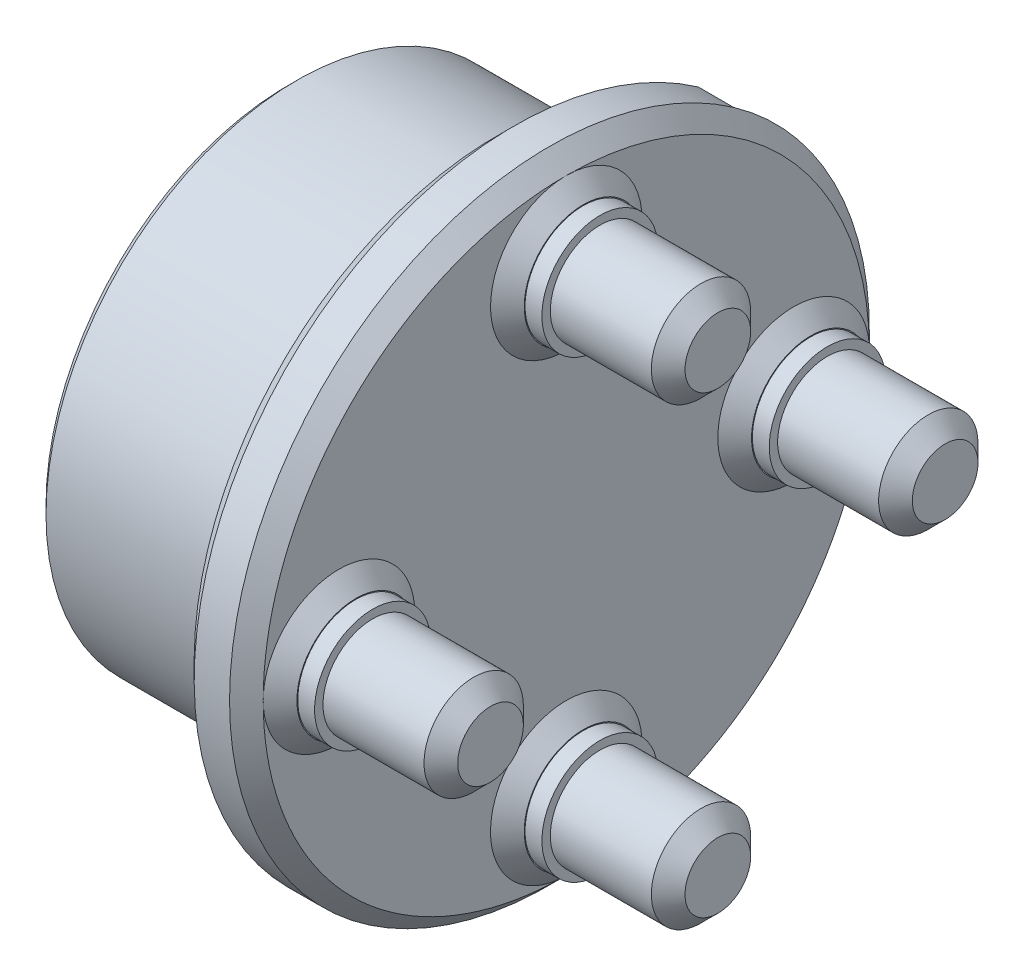
from build123d import *

# Parameters (mm, degrees)
BOSS_EXTRUDE1_OUTLINE_R   = 19
BOSS_EXTRUDE1_DEPTH       = 2
BOSS_EXTRUDE1_START       = -8
BOSS_EXTRUDE1_2_OUTLINE_R = 2.5
BOSS_EXTRUDE1_2_DEPTH     = 8
SKETCH2_R                 = 3.5
CUT_EXTRUDE1_DEPTH        = 29.670542374
SKETCH3_R                 = 2.95
BOSS_EXTRUDE2_DEPTH       = 9
BOSS_EXTRUDE3_START       = 4
SKETCH5_R                 = 3.5
BOSS_EXTRUDE3_DEPTH       = 4
SKETCH6_R                 = 8.643788813
CUT_EXTRUDE2_DEPTH        = 12
BOSS_EXTRUDE4_START       = -2
SKETCH7_R                 = 3.5
BOSS_EXTRUDE4_DEPTH       = 2
SKETCH8_R                 = 12.5
BOSS_EXTRUDE5_DEPTH       = 10
SKETCH9_R                 = 2
CUT_EXTRUDE3_DEPTH        = 4
SKETCH10_R                = 15
SKETCH10_R_2              = 12.5
BOSS_EXTRUDE6_DEPTH       = 10
SKETCH11_R                = 16.225854921
SKETCH11_R_2              = 14.9
CUT_EXTRUDE4_DEPTH        = 10
SKETCH12_R                = 4.5
BOSS_EXTRUDE7_DEPTH       = 1
BOSS_EXTRUDE8_START       = 2
SKETCH13_R                = 14.9
SKETCH13_R_2              = 2
BOSS_EXTRUDE8_DEPTH       = 2
SKETCH14_R                = 3.45
BOSS_EXTRUDE9_DEPTH       = 1
CHAMFER1_SIZE             = 1
CHAMFER2_SIZE             = 1
BOSS_EXTRUDE12_START      = 2.5
SKETCH21_R                = 14.9
SKETCH21_R_2              = 2
BOSS_EXTRUDE12_DEPTH      = 2.5
CHAMFER3_SIZE             = 0.5
SKETCH17_R                = 3.065
BOSS_EXTRUDE10_DEPTH      = 1
CHAMFER5_SIZE             = 0.1
CUT_EXTRUDE7_DEPTH        = 2.1
CUT_EXTRUDE7_DEPTH_BACK   = 1
BOSS_EXTRUDE11_START      = 2.1
BOSS_EXTRUDE11_DEPTH      = 2.1
CHAMFER7_SIZE             = 1
CHAMFER8_SIZE             = 1
CUT_EXTRUDE8_START        = -7
SKETCH22_R                = 7.553732041
SKETCH22_R_2              = 2.95
CUT_EXTRUDE8_DEPTH        = 7
SKETCH23_R                = 3.055522854
SKETCH23_R_2              = 1.975
BOSS_EXTRUDE13_DEPTH      = 8.5
CHAMFER9_SIZE             = 0.5


with BuildPart() as part:
    # Boss-Extrude1: read off the stored shape, not the designer's step
    # Boss-Extrude1 outline → Boss-Extrude1 (new body)
    with BuildSketch(Plane(origin=(8, 0, 0), x_dir=(0, 0, -1), z_dir=(1, 0, 0))):
        Circle(BOSS_EXTRUDE1_OUTLINE_R)
    extrude(amount=BOSS_EXTRUDE1_DEPTH)

    # Boss-Extrude1 2 outline → Boss-Extrude1 2 (add)
    with BuildSketch(Plane(origin=(8, 0, 0), x_dir=(0, 0, -1), z_dir=(1, 0, 0)).offset(BOSS_EXTRUDE1_START)):
        with BuildLine():
            ThreePointArc((-4.827976462, 5.739393982), (-4.973419937, 5.613830611), (-5.115599083, 5.484582575))
            ThreePointArc((-5.115599083, 5.484582575), (-4.796933675, 4.315856884), (-3.983306334, 3.41837266))
            ThreePointArc((-3.983306334, 3.41837266), (-4.319842312, 2.981771856), (-4.608733854, 2.512284471))
            ThreePointArc((-4.608733854, 2.512284471), (-5.736412412, 2.954786958), (-6.942190227, 2.838308449))
            ThreePointArc((-6.942190227, 2.838308449), (-7.01262182, 2.659536653), (-7.078450644, 2.479019256))
            ThreePointArc((-7.078450644, 2.479019256), (-6.253152528, 1.592255251), (-5.115639582, 1.175683915))
            ThreePointArc((-5.115639582, 1.175683915), (-5.21072888, 0.632697034), (-5.24834797, 0.082732007))
            ThreePointArc((-5.24834797, 0.082732007), (-6.452498904, -0.049509856), (-7.466031873, -0.712999344))
            ThreePointArc((-7.466031873, -0.712999344), (-7.445316556, -0.904025102), (-7.419714468, -1.094457498))
            ThreePointArc((-7.419714468, -1.094457498), (-6.276849497, -1.496112872), (-5.076041451, -1.336339847))
            ThreePointArc((-5.076041451, -1.336339847), (-4.907900258, -1.861321052), (-4.685628816, -2.365773362))
            ThreePointArc((-4.685628816, -2.365773362), (-5.690395658, -3.042464558), (-6.279495593, -4.10096758))
            ThreePointArc((-6.279495593, -4.10096758), (-6.172378994, -4.2604856), (-6.061211124, -4.41720723))
            ThreePointArc((-6.061211124, -4.41720723), (-4.862595889, -4.241739566), (-3.873583397, -3.542224254))
            ThreePointArc((-3.873583397, -3.542224254), (-3.480730833, -3.928932917), (-3.049488568, -4.272308565))
            ThreePointArc((-3.049488568, -4.272308565), (-3.624691343, -5.338427296), (-3.654402549, -6.549453566))
            ThreePointArc((-3.654402549, -6.549453566), (-3.48542379, -6.640920192), (-3.314157357, -6.728028018))
            ThreePointArc((-3.314157357, -6.728028018), (-2.334380164, -6.015634844), (-1.783734068, -4.936627773))
            ThreePointArc((-1.783734068, -4.936627773), (-1.256167922, -5.0964736), (-0.714747239, -5.200109363))
            ThreePointArc((-0.714747239, -5.200109363), (-0.728613924, -6.411420676), (-0.192129921, -7.497538669))
            ThreePointArc((-0.192129921, -7.497538669), (0, -7.5), (0.192129921, -7.497538669))
            ThreePointArc((0.192129921, -7.497538669), (0.728613924, -6.411420676), (0.714747239, -5.200109363))
            ThreePointArc((0.714747239, -5.200109363), (1.256167922, -5.0964736), (1.783734068, -4.936627773))
            ThreePointArc((1.783734068, -4.936627773), (2.334380164, -6.015634844), (3.314157357, -6.728028018))
            ThreePointArc((3.314157357, -6.728028018), (3.48542379, -6.640920192), (3.654402549, -6.549453566))
            ThreePointArc((3.654402549, -6.549453566), (3.624691343, -5.338427296), (3.049488568, -4.272308565))
            ThreePointArc((3.049488568, -4.272308565), (3.480730833, -3.928932917), (3.873583397, -3.542224254))
            ThreePointArc((3.873583397, -3.542224254), (4.862595889, -4.241739566), (6.061211124, -4.41720723))
            ThreePointArc((6.061211124, -4.41720723), (6.172378994, -4.2604856), (6.279495593, -4.10096758))
            ThreePointArc((6.279495593, -4.10096758), (5.690395658, -3.042464558), (4.685628816, -2.365773362))
            ThreePointArc((4.685628816, -2.365773362), (4.907900258, -1.861321052), (5.076041451, -1.336339847))
            ThreePointArc((5.076041451, -1.336339847), (6.276849497, -1.496112872), (7.419714468, -1.094457498))
            ThreePointArc((7.419714468, -1.094457498), (7.445316556, -0.904025102), (7.466031873, -0.712999344))
            ThreePointArc((7.466031873, -0.712999344), (6.452498904, -0.049509856), (5.24834797, 0.082732007))
            ThreePointArc((5.24834797, 0.082732007), (5.21072888, 0.632697034), (5.115639582, 1.175683915))
            ThreePointArc((5.115639582, 1.175683915), (6.253152528, 1.592255251), (7.078450644, 2.479019256))
            ThreePointArc((7.078450644, 2.479019256), (7.01262182, 2.659536653), (6.942190227, 2.838308449))
            ThreePointArc((6.942190227, 2.838308449), (5.736412412, 2.954786958), (4.608733854, 2.512284471))
            ThreePointArc((4.608733854, 2.512284471), (4.319842312, 2.981771856), (3.983306334, 3.41837266))
            ThreePointArc((3.983306334, 3.41837266), (4.796933675, 4.315856884), (5.115599083, 5.484582575))
            ThreePointArc((5.115599083, 5.484582575), (4.973419937, 5.613830611), (4.827976462, 5.739393982))
            ThreePointArc((4.827976462, 5.739393982), (3.706182968, 5.282177689), (2.913314353, 4.366302839))
            ThreePointArc((2.913314353, 4.366302839), (2.43933193, 4.647758679), (1.93844561, 4.877953425))
            ThreePointArc((1.93844561, 4.877953425), (2.241795126, 6.050747718), (1.980825421, 7.233694122))
            ThreePointArc((1.980825421, 7.233694122), (1.794867482, 7.282063631), (1.607731473, 7.325653521))
            ThreePointArc((1.607731473, 7.325653521), (0.82691167, 6.399485168), (0.550489643, 5.220053846))
            ThreePointArc((0.550489643, 5.220053846), (0, 5.249), (-0.550489643, 5.220053846))
            ThreePointArc((-0.550489643, 5.220053846), (-0.82691167, 6.399485168), (-1.607731473, 7.325653521))
            ThreePointArc((-1.607731473, 7.325653521), (-1.794867482, 7.282063631), (-1.980825421, 7.233694122))
            ThreePointArc((-1.980825421, 7.233694122), (-2.241795126, 6.050747718), (-1.93844561, 4.877953425))
            ThreePointArc((-1.93844561, 4.877953425), (-2.43933193, 4.647758679), (-2.913314353, 4.366302839))
            ThreePointArc((-2.913314353, 4.366302839), (-3.706182968, 5.282177689), (-4.827976462, 5.739393982))
        make_face()
        Circle(BOSS_EXTRUDE1_2_OUTLINE_R, mode=Mode.SUBTRACT)
    extrude(amount=BOSS_EXTRUDE1_2_DEPTH)

    # Sketch2 → Cut-Extrude1 (cut, through all)
    with BuildSketch(Plane(origin=(10, 0, 0), x_dir=(0, 0, -1), z_dir=(1, 0, 0))):
        Circle(SKETCH2_R)
    extrude(amount=-CUT_EXTRUDE1_DEPTH, mode=Mode.SUBTRACT)

    # Sketch3 → Boss-Extrude2 (add)
    with BuildSketch(Plane(origin=(10, 0, 0), x_dir=(0, 0, -1), z_dir=(1, 0, 0))):
        with Locations((-13.5, 0)):
            Circle(SKETCH3_R)
        with Locations((0, 13.5)):
            Circle(SKETCH3_R)
        with Locations((13.5, 0)):
            Circle(SKETCH3_R)
        with Locations((0, -13.5)):
            Circle(SKETCH3_R)
    extrude(amount=BOSS_EXTRUDE2_DEPTH)

    # Sketch5 → Boss-Extrude3 (add)
    with BuildSketch(Plane.ZY.offset(BOSS_EXTRUDE3_START)):
        with BuildLine():
            ThreePointArc((3.983306334, 3.41837266), (4.796933675, 4.315856884), (5.115599083, 5.484582575))
            ThreePointArc((5.115599083, 5.484582575), (4.973419937, 5.613830611), (4.827976462, 5.739393982))
            ThreePointArc((4.827976462, 5.739393982), (3.706182968, 5.282177689), (2.913314353, 4.366302839))
            ThreePointArc((2.913314353, 4.366302839), (2.43933193, 4.647758679), (1.93844561, 4.877953425))
            ThreePointArc((1.93844561, 4.877953425), (2.241795126, 6.050747718), (1.980825421, 7.233694122))
            ThreePointArc((1.980825421, 7.233694122), (1.794867482, 7.282063631), (1.607731473, 7.325653521))
            ThreePointArc((1.607731473, 7.325653521), (0.82691167, 6.399485168), (0.550489643, 5.220053846))
            ThreePointArc((0.550489643, 5.220053846), (0, 5.249), (-0.550489643, 5.220053846))
            ThreePointArc((-0.550489643, 5.220053846), (-0.82691167, 6.399485168), (-1.607731473, 7.325653521))
            ThreePointArc((-1.607731473, 7.325653521), (-1.794867482, 7.282063631), (-1.980825421, 7.233694122))
            ThreePointArc((-1.980825421, 7.233694122), (-2.241795126, 6.050747718), (-1.93844561, 4.877953425))
            ThreePointArc((-1.93844561, 4.877953425), (-2.43933193, 4.647758679), (-2.913314353, 4.366302839))
            ThreePointArc((-2.913314353, 4.366302839), (-3.706182968, 5.282177689), (-4.827976462, 5.739393982))
            ThreePointArc((-4.827976462, 5.739393982), (-4.973419937, 5.613830611), (-5.115599083, 5.484582575))
            ThreePointArc((-5.115599083, 5.484582575), (-4.796933675, 4.315856884), (-3.983306334, 3.41837266))
            ThreePointArc((-3.983306334, 3.41837266), (-4.319842312, 2.981771856), (-4.608733854, 2.512284471))
            ThreePointArc((-4.608733854, 2.512284471), (-5.736412412, 2.954786958), (-6.942190227, 2.838308449))
            ThreePointArc((-6.942190227, 2.838308449), (-7.01262182, 2.659536653), (-7.078450644, 2.479019256))
            ThreePointArc((-7.078450644, 2.479019256), (-6.253152529, 1.592255251), (-5.115639582, 1.175683915))
            ThreePointArc((-5.115639582, 1.175683915), (-5.21072888, 0.632697035), (-5.24834797, 0.082732007))
            ThreePointArc((-5.24834797, 0.082732007), (-6.452498904, -0.049509856), (-7.466031873, -0.712999344))
            ThreePointArc((-7.466031873, -0.712999344), (-7.445316556, -0.904025102), (-7.419714468, -1.094457498))
            ThreePointArc((-7.419714468, -1.094457498), (-6.276849497, -1.496112872), (-5.076041451, -1.336339847))
            ThreePointArc((-5.076041451, -1.336339847), (-4.907900258, -1.861321052), (-4.685628816, -2.365773362))
            ThreePointArc((-4.685628816, -2.365773362), (-5.690395658, -3.042464558), (-6.279495593, -4.10096758))
            ThreePointArc((-6.279495593, -4.10096758), (-6.172378994, -4.2604856), (-6.061211124, -4.41720723))
            ThreePointArc((-6.061211124, -4.41720723), (-4.862595889, -4.241739566), (-3.873583397, -3.542224254))
            ThreePointArc((-3.873583397, -3.542224254), (-3.480730833, -3.928932917), (-3.049488568, -4.272308565))
            ThreePointArc((-3.049488568, -4.272308565), (-3.624691343, -5.338427296), (-3.654402549, -6.549453566))
            ThreePointArc((-3.654402549, -6.549453566), (-3.48542379, -6.640920192), (-3.314157357, -6.728028018))
            ThreePointArc((-3.314157357, -6.728028018), (-2.334380164, -6.015634844), (-1.783734068, -4.936627773))
            ThreePointArc((-1.783734068, -4.936627773), (-1.256167922, -5.0964736), (-0.714747239, -5.200109363))
            ThreePointArc((-0.714747239, -5.200109363), (-0.728613924, -6.411420676), (-0.192129921, -7.497538669))
            ThreePointArc((-0.192129921, -7.497538669), (0, -7.5), (0.192129921, -7.497538669))
            ThreePointArc((0.192129921, -7.497538669), (0.728613924, -6.411420676), (0.714747239, -5.200109363))
            ThreePointArc((0.714747239, -5.200109363), (1.256167922, -5.0964736), (1.783734068, -4.936627773))
            ThreePointArc((1.783734068, -4.936627773), (2.334380164, -6.015634844), (3.314157357, -6.728028018))
            ThreePointArc((3.314157357, -6.728028018), (3.48542379, -6.640920192), (3.654402549, -6.549453566))
            ThreePointArc((3.654402549, -6.549453566), (3.624691343, -5.338427296), (3.049488568, -4.272308565))
            ThreePointArc((3.049488568, -4.272308565), (3.480730833, -3.928932917), (3.873583397, -3.542224254))
            ThreePointArc((3.873583397, -3.542224254), (4.862595889, -4.241739566), (6.061211124, -4.41720723))
            ThreePointArc((6.061211124, -4.41720723), (6.172378994, -4.2604856), (6.279495593, -4.10096758))
            ThreePointArc((6.279495593, -4.10096758), (5.690395658, -3.042464558), (4.685628816, -2.365773362))
            ThreePointArc((4.685628816, -2.365773362), (4.907900258, -1.861321052), (5.076041451, -1.336339847))
            ThreePointArc((5.076041451, -1.336339847), (6.276849497, -1.496112872), (7.419714468, -1.094457498))
            ThreePointArc((7.419714468, -1.094457498), (7.445316556, -0.904025102), (7.466031873, -0.712999344))
            ThreePointArc((7.466031873, -0.712999344), (6.452498904, -0.049509856), (5.24834797, 0.082732007))
            ThreePointArc((5.24834797, 0.082732007), (5.21072888, 0.632697035), (5.115639582, 1.175683915))
            ThreePointArc((5.115639582, 1.175683915), (6.253152529, 1.592255251), (7.078450644, 2.479019256))
            ThreePointArc((7.078450644, 2.479019256), (7.01262182, 2.659536653), (6.942190227, 2.838308449))
            ThreePointArc((6.942190227, 2.838308449), (5.736412412, 2.954786958), (4.608733854, 2.512284471))
            ThreePointArc((4.608733854, 2.512284471), (4.319842312, 2.981771856), (3.983306334, 3.41837266))
        make_face()
        with Locations(Location((0, 0, 0), (0, 0, 180))):
            Circle(SKETCH5_R, mode=Mode.SUBTRACT)
    extrude(amount=-BOSS_EXTRUDE3_DEPTH)

    # Sketch6 → Cut-Extrude2 (cut)
    with BuildSketch(Plane.ZY.offset(4)):
        Circle(SKETCH6_R)
    extrude(amount=-CUT_EXTRUDE2_DEPTH, mode=Mode.SUBTRACT)

    # Sketch7 → Boss-Extrude4 (add)
    with BuildSketch(Plane.ZY.offset(-8).offset(BOSS_EXTRUDE4_START)):
        Circle(SKETCH7_R)
    extrude(amount=BOSS_EXTRUDE4_DEPTH)

    # Sketch8 → Boss-Extrude5 (add)
    with BuildSketch(Plane.ZY.offset(-8)):
        Circle(SKETCH8_R)
    extrude(amount=BOSS_EXTRUDE5_DEPTH)

    # Sketch9 → Cut-Extrude3 (cut)
    with BuildSketch(Plane.ZY.offset(2)):
        with Locations((-10, 0)):
            Circle(SKETCH9_R)
        with Locations((0, 10)):
            Circle(SKETCH9_R)
        with Locations((10, 0)):
            Circle(SKETCH9_R)
        with Locations((0, -10)):
            Circle(SKETCH9_R)
    extrude(amount=-CUT_EXTRUDE3_DEPTH, mode=Mode.SUBTRACT)

    # Sketch10 → Boss-Extrude6 (add)
    with BuildSketch(Plane.ZY.offset(-8)):
        with Locations(Location((0, 0, 0), (0, 0, 180))):
            Circle(SKETCH10_R)
        Circle(SKETCH10_R_2, mode=Mode.SUBTRACT)
    extrude(amount=BOSS_EXTRUDE6_DEPTH)

    # Sketch11 → Cut-Extrude4 (cut)
    with BuildSketch(Plane.ZY.offset(2)):
        Circle(SKETCH11_R)
        Circle(SKETCH11_R_2, mode=Mode.SUBTRACT)
    extrude(amount=-CUT_EXTRUDE4_DEPTH, mode=Mode.SUBTRACT)

    # Sketch12 → Boss-Extrude7 (add)
    with BuildSketch(Plane(origin=(10, 0, 0), x_dir=(0, 0, -1), z_dir=(1, 0, 0))):
        with Locations((-13.5, 0)):
            Circle(SKETCH12_R)
        with Locations((0, 13.5)):
            Circle(SKETCH12_R)
        with Locations((13.5, 0)):
            Circle(SKETCH12_R)
        with Locations((0, -13.5)):
            Circle(SKETCH12_R)
    extrude(amount=BOSS_EXTRUDE7_DEPTH)

    # Sketch13 → Boss-Extrude8 (add)
    with BuildSketch(Plane.ZY.offset(2).offset(BOSS_EXTRUDE8_START)):
        Circle(SKETCH13_R)
        with Locations((-10, 0)):
            Circle(SKETCH13_R_2, mode=Mode.SUBTRACT)
        with Locations((0, 10)):
            Circle(SKETCH13_R_2, mode=Mode.SUBTRACT)
        with Locations((10, 0)):
            Circle(SKETCH13_R_2, mode=Mode.SUBTRACT)
        with Locations((0, -10)):
            Circle(SKETCH13_R_2, mode=Mode.SUBTRACT)
    extrude(amount=-BOSS_EXTRUDE8_DEPTH)

    # Sketch14 → Boss-Extrude9 (add)
    with BuildSketch(Plane(origin=(11, 0, 0), x_dir=(0, 0, -1), z_dir=(1, 0, 0))):
        with Locations((-13.5, 0)):
            Circle(SKETCH14_R)
        with Locations((0, 13.5)):
            Circle(SKETCH14_R)
        with Locations((13.5, 0)):
            Circle(SKETCH14_R)
        with Locations((0, -13.5)):
            Circle(SKETCH14_R)
    extrude(amount=BOSS_EXTRUDE9_DEPTH)

    # Chamfer1
    chamfer1_edges = [part.edges().sort_by_distance(p)[0] for p in [
        (11, 0, 18),
        (11, 13.5, 4.5),
        (11, 0, -9),
        (11, -13.5, 4.5),
    ]]
    chamfer(chamfer1_edges, length=CHAMFER1_SIZE - 0.0001)  # a hair under: the kernel refuses the full size

    # Chamfer2
    chamfer2_edges = [part.edges().sort_by_distance(p)[0] for p in [
        (19, 0, 16.45),
        (19, 13.5, 2.95),
        (19, 0, -10.55),
        (19, -13.5, 2.95),
    ]]
    chamfer(chamfer2_edges, length=CHAMFER2_SIZE)

    # Sketch21 → Boss-Extrude12 (add)
    with BuildSketch(Plane.ZY.offset(4).offset(BOSS_EXTRUDE12_START)):
        Circle(SKETCH21_R)
        with Locations((-10, 0)):
            Circle(SKETCH21_R_2, mode=Mode.SUBTRACT)
        with Locations((0, 10)):
            Circle(SKETCH21_R_2, mode=Mode.SUBTRACT)
        with Locations((10, 0)):
            Circle(SKETCH21_R_2, mode=Mode.SUBTRACT)
        with Locations((0, -10)):
            Circle(SKETCH21_R_2, mode=Mode.SUBTRACT)
    extrude(amount=-BOSS_EXTRUDE12_DEPTH)

    # Chamfer3
    chamfer3_edges = [part.edges().sort_by_distance(p)[0] for p in [
        (-6.5, 0, -14.9),
    ]]
    chamfer(chamfer3_edges, length=CHAMFER3_SIZE)

    # Sketch17 → Boss-Extrude10 (add)
    with BuildSketch(Plane(origin=(15, 0, 0), x_dir=(0, 0, -1), z_dir=(1, 0, 0))):
        with Locations((0, 13.5)):
            Circle(SKETCH17_R)
        with Locations((13.5, 0)):
            Circle(SKETCH17_R)
        with Locations((0, -13.5)):
            Circle(SKETCH17_R)
        with Locations((-13.5, 0)):
            Circle(SKETCH17_R)
    extrude(amount=BOSS_EXTRUDE10_DEPTH)

    # Chamfer5
    chamfer5_edges = [part.edges().sort_by_distance(p)[0] for p in [
        (16, 13.5, 3.065),
        (16, 0, -10.435),
        (16, -13.5, 3.065),
        (16, 0, 16.565),
    ]]
    chamfer(chamfer5_edges, length=CHAMFER5_SIZE)

    # Sketch19 → Cut-Extrude7 (cut, two sides: drawn at the far end of the back side and taken through both)
    with BuildSketch(Plane.ZY.offset(-8).offset(-CUT_EXTRUDE7_DEPTH_BACK)):
        with BuildLine():
            Line((-8.308504679, 12.904698757), (-10.951006704, 15.547200782))
            ThreePointArc((-10.951006704, 15.547200782), (-13.446932736, 13.446932736), (-15.547200782, 10.951006704))
            Line((-15.547200782, 10.951006704), (-12.904698757, 8.308504679))
            ThreePointArc((-12.904698757, 8.308504679), (-8.308504679, 8.308504679), (-8.308504679, 12.904698757))
        make_face()
    extrude(amount=CUT_EXTRUDE7_DEPTH + CUT_EXTRUDE7_DEPTH_BACK, mode=Mode.SUBTRACT)

    # Sketch20 → Boss-Extrude11 (add)
    with BuildSketch(Plane.ZY.offset(-8).offset(BOSS_EXTRUDE11_START)):
        with BuildLine():
            Line((-15.535118985, 10.938924907), (-12.562954218, 8.011378241))
            ThreePointArc((-12.562954218, 8.011378241), (10.53589104, -10.53589104), (-8.011378241, 12.562954218))
            Line((-8.011378241, 12.562954218), (-10.938924907, 15.535118985))
            ThreePointArc((-10.938924907, 15.535118985), (13.435028843, -13.435028843), (-15.535118985, 10.938924907))
        make_face()
    extrude(amount=-BOSS_EXTRUDE11_DEPTH)

    # Chamfer7
    chamfer7_edges = [part.edges().sort_by_distance(p)[0] for p in [
        (5.9, -13.435028843, 13.435028843),
    ]]
    chamfer(chamfer7_edges, length=CHAMFER7_SIZE)

    # Chamfer8
    chamfer8_edges = [part.edges().sort_by_distance(p)[0] for p in [
        (10, 0, 19),
    ]]
    chamfer(chamfer8_edges, length=CHAMFER8_SIZE - 0.0001)  # a hair under: the kernel refuses the full size

    # Sketch22 → Cut-Extrude8 (cut)
    # profile 1 of 4: a face of its own
    with BuildSketch(Plane(origin=(19, 0, 0), x_dir=(0, 0, -1), z_dir=(1, 0, 0)).offset(CUT_EXTRUDE8_START)):
        with Locations((0, 13.5)):
            Circle(SKETCH22_R)
        with Locations((0, 13.5)):
            Circle(SKETCH22_R_2, mode=Mode.SUBTRACT)
    # profile 2 of 4: a face of its own
    with BuildSketch(Plane(origin=(19, 0, 0), x_dir=(0, 0, -1), z_dir=(1, 0, 0)).offset(CUT_EXTRUDE8_START)):
        with Locations((13.5, 0)):
            Circle(SKETCH22_R)
        with Locations((13.5, 0)):
            Circle(SKETCH22_R_2, mode=Mode.SUBTRACT)
    # profile 3 of 4: a face of its own
    with BuildSketch(Plane(origin=(19, 0, 0), x_dir=(0, 0, -1), z_dir=(1, 0, 0)).offset(CUT_EXTRUDE8_START)):
        with Locations((0, -13.5)):
            Circle(SKETCH22_R)
        with Locations((0, -13.5)):
            Circle(SKETCH22_R_2, mode=Mode.SUBTRACT)
    # profile 4 of 4: a face of its own
    with BuildSketch(Plane(origin=(19, 0, 0), x_dir=(0, 0, -1), z_dir=(1, 0, 0)).offset(CUT_EXTRUDE8_START)):
        with Locations((-13.5, 0)):
            Circle(SKETCH22_R)
        with Locations((-13.5, 0)):
            Circle(SKETCH22_R_2, mode=Mode.SUBTRACT)
    extrude(amount=CUT_EXTRUDE8_DEPTH, mode=Mode.SUBTRACT)

    # Sketch23 → Boss-Extrude13 (add)
    # profile 1 of 4: a face of its own
    with BuildSketch(Plane.ZY.offset(-2)):
        with Locations((-10, 0)):
            Circle(SKETCH23_R)
        with Locations((-10, 0)):
            Circle(SKETCH23_R_2, mode=Mode.SUBTRACT)
    # profile 2 of 4: a face of its own
    with BuildSketch(Plane.ZY.offset(-2)):
        with Locations((0, 10)):
            Circle(SKETCH23_R)
        with Locations((0, 10)):
            Circle(SKETCH23_R_2, mode=Mode.SUBTRACT)
    # profile 3 of 4: a face of its own
    with BuildSketch(Plane.ZY.offset(-2)):
        with Locations((10, 0)):
            Circle(SKETCH23_R)
        with Locations((10, 0)):
            Circle(SKETCH23_R_2, mode=Mode.SUBTRACT)
    # profile 4 of 4: a face of its own
    with BuildSketch(Plane.ZY.offset(-2)):
        with Locations((0, -10)):
            Circle(SKETCH23_R)
        with Locations((0, -10)):
            Circle(SKETCH23_R_2, mode=Mode.SUBTRACT)
    extrude(amount=BOSS_EXTRUDE13_DEPTH)

    # Chamfer9
    chamfer9_edges = [part.edges().sort_by_distance(p)[0] for p in [
        (-6.5, 0, -11.975),
        (-6.5, 10, -1.975),
        (-6.5, 0, 8.025),
        (-6.5, -10, -1.975),
    ]]
    chamfer(chamfer9_edges, length=CHAMFER9_SIZE)


solid = part.part
